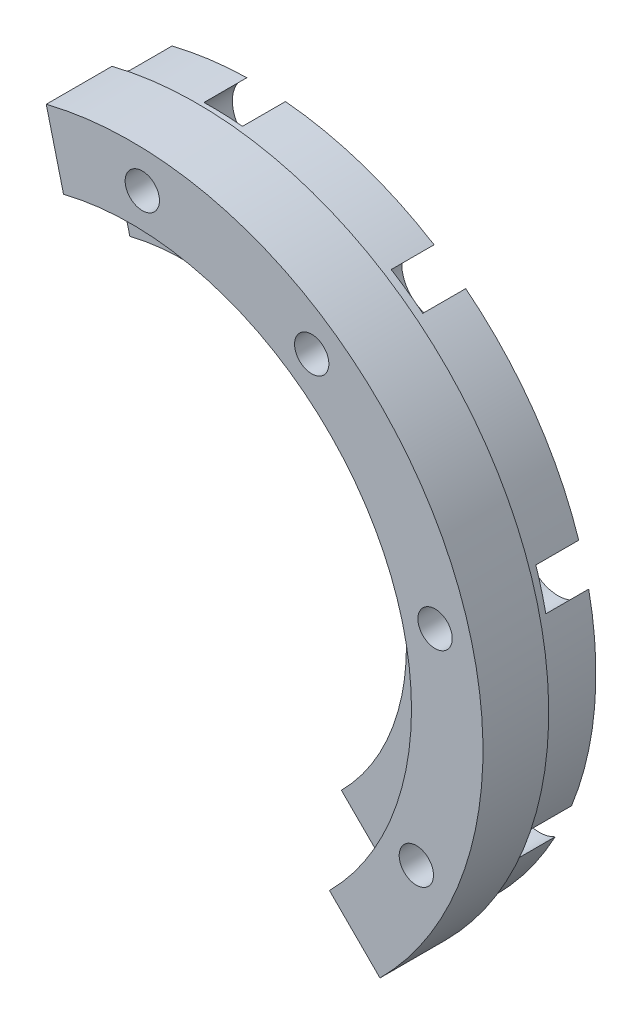
from build123d import *

# Parameters (mm, degrees)
BOSS_1_DEPTH  = 5.6
BOSS_2_DEPTH  = 4.95
CUT_3_DEPTH   = 1.1
CUT_4_DEPTH   = 1.1
S_HOLE5_R     = 1.2
HOLE_5_DEPTH  = 8.8
S_HOLE6_R     = 2.3
HOLE_6_DEPTH  = 3.1
S_HOLE7_R     = 1.2
HOLE_7_DEPTH  = 8.8
S_HOLE8_R     = 2.3
HOLE_8_DEPTH  = 3.1
S_HOLE9_R     = 1.2
HOLE_9_DEPTH  = 8.8
S_HOLE10_R    = 2.3
HOLE_10_DEPTH = 3.1
S_HOLE11_R    = 1.2
HOLE_11_DEPTH = 8.8
S_HOLE12_R    = 2.3
HOLE_12_DEPTH = 3.1


with BuildPart() as part:
    # S_prism1 → Boss_1 (new body)
    with BuildSketch(Plane.XY.offset(24.6)):
        with BuildLine():
            Line((-5.951278632, 23.869274866), (-4.741669154, 19.017796235))
            ThreePointArc((-4.741669154, 19.017796235), (17.05897164, 9.651501778), (13.859292911, -13.859292911))
            Line((13.859292911, -13.859292911), (17.394826817, -17.394826817))
            ThreePointArc((17.394826817, -17.394826817), (21.41075012, 12.113619579), (-5.951278632, 23.869274866))
        make_face()
    extrude(amount=BOSS_1_DEPTH)

    # S_prism2 → Boss_2 (add)
    with BuildSketch(Plane.XY.offset(21.6)):
        with BuildLine():
            Line((-5.753596984, 23.197114513), (-3.755485898, 15.14121282))
            ThreePointArc((-3.755485898, 15.14121282), (13.577548857, 7.681807538), (11.044334296, -11.017380812))
            Line((11.044334296, -11.017380812), (16.920486517, -16.879192399))
            ThreePointArc((16.920486517, -16.879192399), (20.801501133, 11.768923086), (-5.753596984, 23.197114513))
        make_face()
    extrude(amount=BOSS_2_DEPTH)

    # S_pcut3 → Cut_3 (cut)
    with BuildSketch(Plane.XY.offset(24.5)):
        with BuildLine():
            Line((-6.418712319, 23.954960492), (-6.185775178, 23.085627248))
            ThreePointArc((-6.185775178, 23.085627248), (20.801501133, 11.768923086), (16.602335054, -17.192221228))
            Line((16.602335054, -17.192221228), (17.227527587, -17.839627048))
            ThreePointArc((17.227527587, -17.839627048), (21.584821259, 12.212104291), (-6.418712319, 23.954960492))
        make_face()
    extrude(amount=CUT_3_DEPTH, mode=Mode.SUBTRACT)

    # S_pcut4 → Cut_4 (cut)
    with BuildSketch(Plane.XY.offset(21.5)):
        with BuildLine():
            Line((-4.399923767, 16.420739047), (-4.011695199, 14.971850307))
            ThreePointArc((-4.011695199, 14.971850307), (13.490513287, 7.632565182), (10.767204742, -11.149766905))
            Line((10.767204742, -11.149766905), (11.809192298, -12.228776606))
            ThreePointArc((11.809192298, -12.228776606), (14.796046831, 8.371200522), (-4.399923767, 16.420739047))
        make_face()
    extrude(amount=CUT_4_DEPTH, mode=Mode.SUBTRACT)

    # S_hole5 → Hole_5 (cut)
    with BuildSketch(Plane.XY.offset(21.5)):
        with Locations((19.938771315, -9.297601758)):
            Circle(S_HOLE5_R)
    extrude(amount=HOLE_5_DEPTH, mode=Mode.SUBTRACT)

    # S_hole6 → Hole_6 (cut)
    with BuildSketch(Plane.XY.offset(21.5)):
        with Locations((19.938771315, -9.297601758)):
            Circle(S_HOLE6_R)
    extrude(amount=HOLE_6_DEPTH, mode=Mode.SUBTRACT)

    # S_hole7 → Hole_7 (cut)
    with BuildSketch(Plane.XY.offset(21.5)):
        with Locations((21.250368178, 5.694018992)):
            Circle(S_HOLE7_R)
    extrude(amount=HOLE_7_DEPTH, mode=Mode.SUBTRACT)

    # S_hole8 → Hole_8 (cut)
    with BuildSketch(Plane.XY.offset(21.5)):
        with Locations((21.250368178, 5.694018992)):
            Circle(S_HOLE8_R)
    extrude(amount=HOLE_8_DEPTH, mode=Mode.SUBTRACT)

    # S_hole9 → Hole_9 (cut)
    with BuildSketch(Plane.XY.offset(21.5)):
        with Locations((12.6186816, 18.021344974)):
            Circle(S_HOLE9_R)
    extrude(amount=HOLE_9_DEPTH, mode=Mode.SUBTRACT)

    # S_hole10 → Hole_10 (cut)
    with BuildSketch(Plane.XY.offset(21.5)):
        with Locations((12.6186816, 18.021344974)):
            Circle(S_HOLE10_R)
    extrude(amount=HOLE_10_DEPTH, mode=Mode.SUBTRACT)

    # S_hole11 → Hole_11 (cut)
    with BuildSketch(Plane.XY.offset(21.5)):
        with Locations((0.767788927, 21.986598194)):
            Circle(S_HOLE11_R)
    extrude(amount=HOLE_11_DEPTH, mode=Mode.SUBTRACT)

    # S_hole12 → Hole_12 (cut)
    with BuildSketch(Plane.XY.offset(21.5)):
        with Locations((0.767788927, 21.986598194)):
            Circle(S_HOLE12_R)
    extrude(amount=HOLE_12_DEPTH, mode=Mode.SUBTRACT)


solid = part.part
